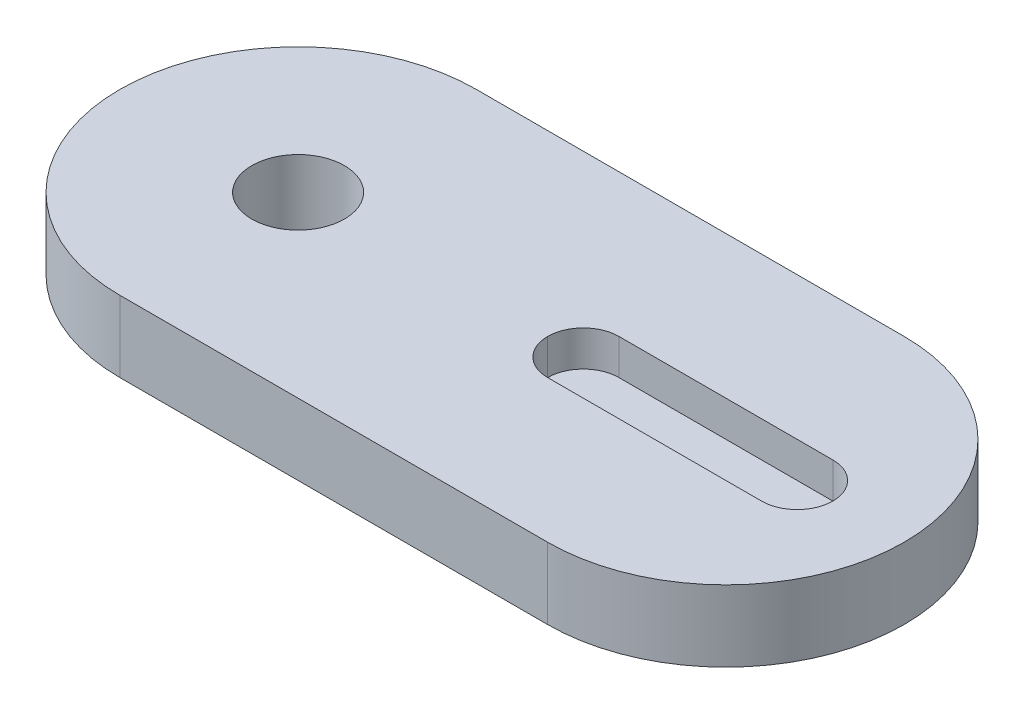
from build123d import *

# Parameters (mm, degrees)
BOSS_EXTRUDE1_DEPTH = 2.54
SKETCH2_R           = 1.651
CUT_EXTRUDE1_DEPTH  = 2.54
SKETCH3_W           = 10.16
SKETCH3_H           = 2.54
CUT_EXTRUDE2_DEPTH  = 1.27
FILLET1_R           = 1.27


with BuildPart() as part:
    # Sketch1 → Boss-Extrude1 (new body)
    with BuildSketch(Plane(origin=(0, 0, 0), x_dir=(1, 0, 0), z_dir=(0, 1, 0))):
        with BuildLine():
            Line((0, 6.35), (15.24, 6.35))
            ThreePointArc((15.24, 6.35), (21.59, 0), (15.24, -6.35))
            Line((15.24, -6.35), (0, -6.35))
            ThreePointArc((0, -6.35), (-6.35, 0), (0, 6.35))
        make_face()
    extrude(amount=BOSS_EXTRUDE1_DEPTH)

    # Sketch2 → Cut-Extrude1 (cut)
    with BuildSketch(Plane(origin=(0, 2.54, 0), x_dir=(1, 0, 0), z_dir=(0, 1, 0))):
        with Locations(Location((0, 0, 0), (0, 0, 270))):
            Circle(SKETCH2_R)
    extrude(amount=-CUT_EXTRUDE1_DEPTH, mode=Mode.SUBTRACT)

    # Sketch3 → Cut-Extrude2 (cut)
    with BuildSketch(Plane(origin=(0, 2.54, 0), x_dir=(1, 0, 0), z_dir=(0, 1, 0))):
        with Locations((13.97, 0)):
            Rectangle(SKETCH3_W, SKETCH3_H)
    extrude(amount=-CUT_EXTRUDE2_DEPTH, mode=Mode.SUBTRACT)

    # Fillet1
    fillet1_edges = [part.edges().sort_by_distance(p)[0] for p in [
        (19.05, 1.905, 1.27),
        (19.05, 1.905, -1.27),
        (8.89, 1.905, 1.27),
        (8.89, 1.905, -1.27),
    ]]
    fillet(fillet1_edges, radius=FILLET1_R - 0.0001)  # a hair under: the kernel refuses the full size


solid = part.part
